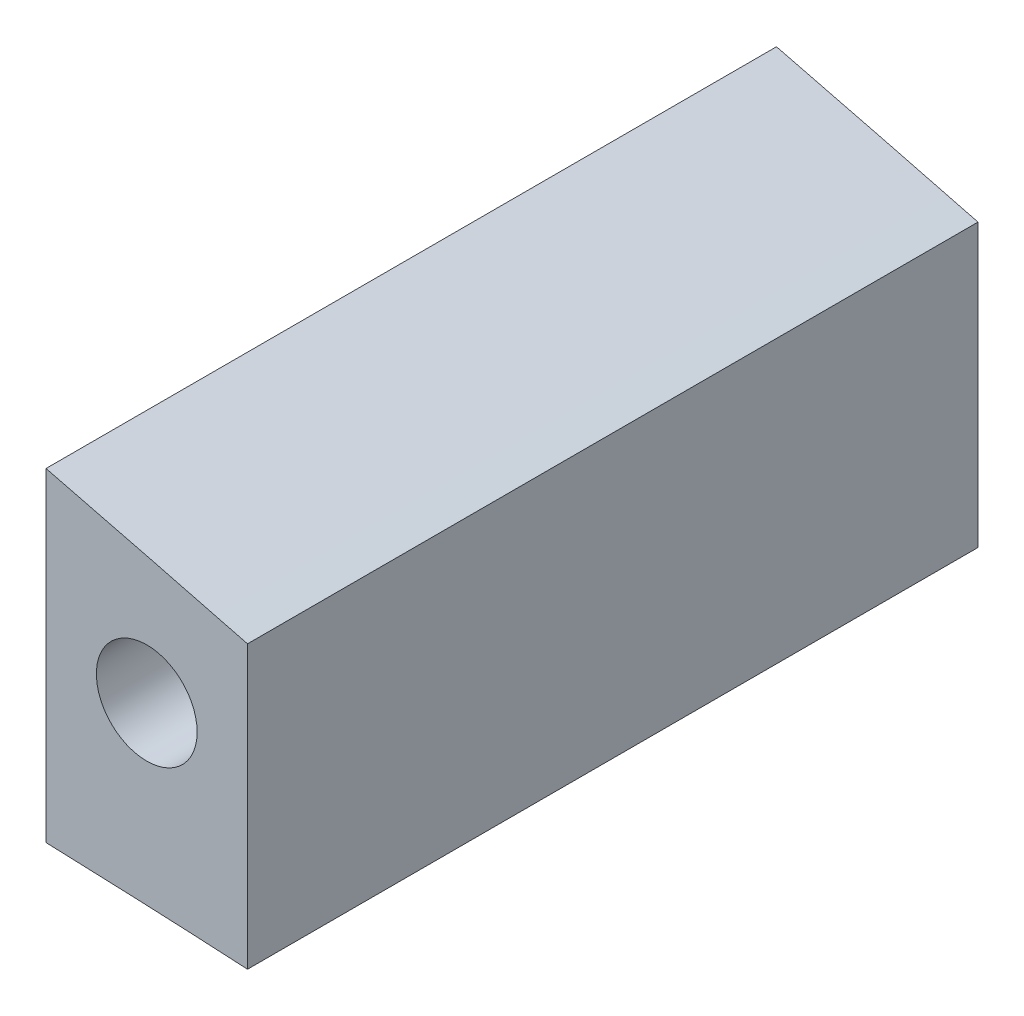
from build123d import *

# Parameters (mm, degrees)
BOSS_EXTRUDE1_DEPTH = 46.0375
SKETCH2_R           = 6.35
SKETCH2_R_2         = 3.175
CUT_EXTRUDE1_DEPTH  = 320.066790275
SKETCH3_W           = 116.84
SKETCH3_H           = 50.8
CUT_EXTRUDE2_DEPTH  = 320.066790275
SKETCH4_W           = 250.150530068
SKETCH4_H           = 117.489254048
CUT_EXTRUDE3_DEPTH  = 243.977084497


with BuildPart() as part:
    # Sketch1 → Boss-Extrude1 (new body)
    with BuildSketch(Plane.XY):
        with BuildLine():
            add(Edge.make_bspline(
                [(0.000560351, 0.000130087), (0.810633127, 7.359196055), (8.649092025, 17.856605174), (26.286719818, 29.975176328), (52.111128271, 42.069215275), (89.597618475, 49.290763054), (131.400792109, 47.884831915), (173.256699242, 40.041104278), (217.961060472, 29.612974894), (256.952064401, 19.528920948), (290.35983767, 8.71099439), (301.273197721, 4.382828139), (314.816918223, -0.516206742), (309.846313895, 0.000130087)],
                knots=[0, 0, 0, 0, 0.060863618, 0.113688265, 0.188608742, 0.312908923, 0.448482434, 0.557612135, 0.691544113, 0.852438279, 0.92975597, 0.976058229, 1, 1, 1, 1], degree=3))
            add(Edge.make_bspline(
                [(309.846313895, 0.000130087), (303.956832565, 1.47095521), (293.989507544, 2.093987313), (276.26402299, 4.514356704), (260.846344817, 5.427413394), (235.858814759, 7.870306192), (205.101424636, 8.838080282), (157.718638092, 9.030650149), (110.497331172, 6.181495223), (66.506197185, -0.586669107), (36.454672816, -6.098499901), (15.316603331, -6.189065841), (1.230714189, -6.924076091), (0.000560351, 0.000130087)],
                knots=[0, 0, 0, 0, 0.057787081, 0.095274891, 0.171021118, 0.205339302, 0.335319146, 0.464904334, 0.658702312, 0.785511947, 0.893517288, 0.94309214, 1, 1, 1, 1], degree=3))
        make_face()
    extrude(amount=BOSS_EXTRUDE1_DEPTH)

    # Sketch2 → Cut-Extrude1 (cut, through all)
    with BuildSketch(Plane.XY.offset(46.0375)):
        with Locations((20.32, 10.16)):
            Circle(SKETCH2_R)
        with Locations((227.296313895, 19.050130087)):
            Circle(SKETCH2_R_2)
    extrude(amount=-CUT_EXTRUDE1_DEPTH, mode=Mode.SUBTRACT)

    # Sketch3 → Cut-Extrude2 (cut, through all)
    with BuildSketch(Plane.XY.offset(46.0375)):
        with Locations((292.066313895, 19.050130087)):
            Rectangle(SKETCH3_W, SKETCH3_H)
    extrude(amount=-CUT_EXTRUDE2_DEPTH, mode=Mode.SUBTRACT)

    # Sketch4 → Cut-Extrude3 (cut, through all)
    with BuildSketch(Plane.XY.offset(46.0375)):
        with Locations((95.871048861, 34.528076629)):
            Rectangle(SKETCH4_W, SKETCH4_H)
    extrude(amount=-CUT_EXTRUDE3_DEPTH, mode=Mode.SUBTRACT)


solid = part.part
